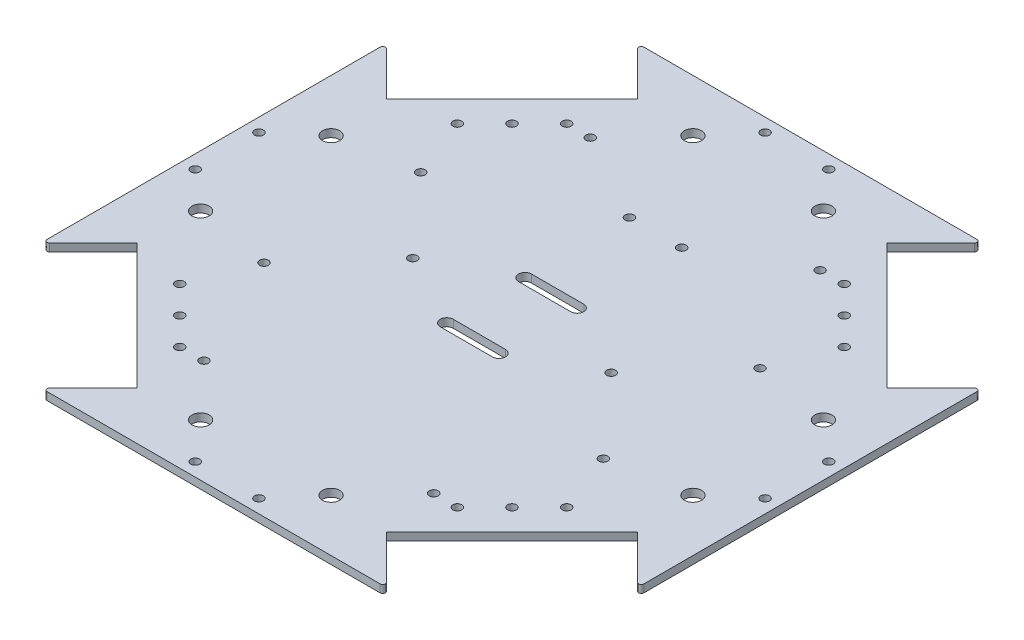
from build123d import *

# Parameters (mm, degrees)
SKETCH1_W                                   = 228.6
SKETCH1_H                                   = 228.6
PLATE_DEPTH                                 = 3
SKETCH8_R                                   = 1.7
MOTOR_MOUNT_HOLES_DEPTH                     = 3
SKETCH9_R                                   = 1.7
CONNECTOR_BOARD_HOLES_DEPTH                 = 3
MOTOR_CONTROLLER_HOLDER_ARDUINO_HOLES_REACH = 163.672
SKETCH11_R                                  = 1.7
CABLE_SLOTS_REACH                           = 163.672
WALL_BRACKET_HOLES_REACH                    = 163.672
SKETCH13_R                                  = 1.7
BATTERY_HOLDER_HOLES_REACH                  = 163.672
SKETCH14_R                                  = 1.7
LOAD_MOUNT_HOLES_REACH                      = 163.672
SKETCH15_R                                  = 3.3
LEVEL2_STANDOFF_HOLES_REACH                 = 163.672
SKETCH10_R                                  = 1.7
WHEEL_SLOTS_DEPTH                           = 3
FILLET1_R                                   = 1


with BuildPart() as part:
    # Sketch1 → plate (new body)
    with BuildSketch(Plane(origin=(0, 0, 0), x_dir=(1, 0, 0), z_dir=(0, 1, 0))):
        Rectangle(SKETCH1_W, SKETCH1_H)
    extrude(amount=PLATE_DEPTH)

    # Sketch8 → motor-mount-holes (cut)
    with BuildSketch(Plane(origin=(0, 3, 0), x_dir=(1, 0, 0), z_dir=(0, 1, 0))):
        with Locations((63.639610307, 63.639610307)):
            Circle(SKETCH8_R)
        with Locations((74.104790668, 53.174429945)):
            Circle(SKETCH8_R)
        with Locations((53.174429945, 74.104790668)):
            Circle(SKETCH8_R)
        with Locations((63.639610307, -63.639610307)):
            Circle(SKETCH8_R)
        with Locations((74.104790668, -53.174429945)):
            Circle(SKETCH8_R)
        with Locations((53.174429945, -74.104790668)):
            Circle(SKETCH8_R)
        with Locations((-63.639610307, -63.639610307)):
            Circle(SKETCH8_R)
        with Locations((-53.174429945, -74.104790668)):
            Circle(SKETCH8_R)
        with Locations((-74.104790668, -53.174429945)):
            Circle(SKETCH8_R)
        with Locations((-63.639610307, 63.639610307)):
            Circle(SKETCH8_R)
        with Locations((-74.104790668, 53.174429945)):
            Circle(SKETCH8_R)
        with Locations((-53.174429945, 74.104790668)):
            Circle(SKETCH8_R)
    extrude(amount=-MOTOR_MOUNT_HOLES_DEPTH, mode=Mode.SUBTRACT)

    # Sketch9 → connector-board-holes (cut)
    with BuildSketch(Plane(origin=(0, 3, 0), x_dir=(1, 0, 0), z_dir=(0, 1, 0))):
        with Locations((-38, 0)):
            Circle(SKETCH9_R)
        with Locations((38, 0)):
            Circle(SKETCH9_R)
    extrude(amount=-CONNECTOR_BOARD_HOLES_DEPTH, mode=Mode.SUBTRACT)

    # Sketch11 → motor-controller-holder-arduino-holes (cut, up to next)
    with BuildSketch(Plane(origin=(0, 3, 0), x_dir=(1, 0, 0), z_dir=(0, 1, 0)), mode=Mode.PRIVATE) as motor_controller_holder_arduino_holes_sk1:
        with Locations((-10, 55)):
            Circle(SKETCH11_R)
    motor_controller_holder_arduino_holes_tool1 = extrude(motor_controller_holder_arduino_holes_sk1.sketch, amount=-MOTOR_CONTROLLER_HOLDER_ARDUINO_HOLES_REACH, mode=Mode.PRIVATE) & part.part
    # Sketch11 → motor-controller-holder-arduino-holes (cut, up to next)
    with BuildSketch(Plane(origin=(0, 3, 0), x_dir=(1, 0, 0), z_dir=(0, 1, 0)), mode=Mode.PRIVATE) as motor_controller_holder_arduino_holes_sk2:
        with Locations((10, 55)):
            Circle(SKETCH11_R)
    motor_controller_holder_arduino_holes_tool2 = extrude(motor_controller_holder_arduino_holes_sk2.sketch, amount=-MOTOR_CONTROLLER_HOLDER_ARDUINO_HOLES_REACH, mode=Mode.PRIVATE) & part.part
    add(motor_controller_holder_arduino_holes_tool1.solids().sort_by_distance((-10, 3, -55))[0], mode=Mode.SUBTRACT)
    add(motor_controller_holder_arduino_holes_tool2.solids().sort_by_distance((10, 3, -55))[0], mode=Mode.SUBTRACT)

    # Sketch12 → cable-slots (cut, up to next)
    with BuildSketch(Plane(origin=(0, 3, 0), x_dir=(1, 0, 0), z_dir=(0, 1, 0)), mode=Mode.PRIVATE) as cable_slots_sk1:
        with BuildLine():
            Line((-10, 17.5), (10, 17.5))
            ThreePointArc((10, 17.5), (12.5, 15), (10, 12.5))
            Line((10, 12.5), (-10, 12.5))
            ThreePointArc((-10, 12.5), (-12.5, 15), (-10, 17.5))
        make_face()
    cable_slots_tool1 = extrude(cable_slots_sk1.sketch, amount=-CABLE_SLOTS_REACH, mode=Mode.PRIVATE) & part.part
    # Sketch12 → cable-slots (cut, up to next)
    with BuildSketch(Plane(origin=(0, 3, 0), x_dir=(1, 0, 0), z_dir=(0, 1, 0)), mode=Mode.PRIVATE) as cable_slots_sk2:
        with BuildLine():
            Line((-10, -12.5), (10, -12.5))
            ThreePointArc((10, -12.5), (12.5, -15), (10, -17.5))
            Line((10, -17.5), (-10, -17.5))
            ThreePointArc((-10, -17.5), (-12.5, -15), (-10, -12.5))
        make_face()
    cable_slots_tool2 = extrude(cable_slots_sk2.sketch, amount=-CABLE_SLOTS_REACH, mode=Mode.PRIVATE) & part.part
    add(cable_slots_tool1.solids().sort_by_distance((0, 3, -15))[0], mode=Mode.SUBTRACT)
    add(cable_slots_tool2.solids().sort_by_distance((0, 3, 15))[0], mode=Mode.SUBTRACT)

    # Sketch13 → wall-bracket-holes (cut, up to next)
    with BuildSketch(Plane(origin=(0, 3, 0), x_dir=(1, 0, 0), z_dir=(0, 1, 0)), mode=Mode.PRIVATE) as wall_bracket_holes_sk1:
        with Locations((-12.2, 109.1438)):
            Circle(SKETCH13_R)
    wall_bracket_holes_tool1 = extrude(wall_bracket_holes_sk1.sketch, amount=-WALL_BRACKET_HOLES_REACH, mode=Mode.PRIVATE) & part.part
    # Sketch13 → wall-bracket-holes (cut, up to next)
    with BuildSketch(Plane(origin=(0, 3, 0), x_dir=(1, 0, 0), z_dir=(0, 1, 0)), mode=Mode.PRIVATE) as wall_bracket_holes_sk2:
        with Locations((12.2, 109.1438)):
            Circle(SKETCH13_R)
    wall_bracket_holes_tool2 = extrude(wall_bracket_holes_sk2.sketch, amount=-WALL_BRACKET_HOLES_REACH, mode=Mode.PRIVATE) & part.part
    # Sketch13 → wall-bracket-holes (cut, up to next)
    with BuildSketch(Plane(origin=(0, 3, 0), x_dir=(1, 0, 0), z_dir=(0, 1, 0)), mode=Mode.PRIVATE) as wall_bracket_holes_sk3:
        with Locations((109.1438, -12.2)):
            Circle(SKETCH13_R)
    wall_bracket_holes_tool3 = extrude(wall_bracket_holes_sk3.sketch, amount=-WALL_BRACKET_HOLES_REACH, mode=Mode.PRIVATE) & part.part
    # Sketch13 → wall-bracket-holes (cut, up to next)
    with BuildSketch(Plane(origin=(0, 3, 0), x_dir=(1, 0, 0), z_dir=(0, 1, 0)), mode=Mode.PRIVATE) as wall_bracket_holes_sk4:
        with Locations((109.1438, 12.2)):
            Circle(SKETCH13_R)
    wall_bracket_holes_tool4 = extrude(wall_bracket_holes_sk4.sketch, amount=-WALL_BRACKET_HOLES_REACH, mode=Mode.PRIVATE) & part.part
    # Sketch13 → wall-bracket-holes (cut, up to next)
    with BuildSketch(Plane(origin=(0, 3, 0), x_dir=(1, 0, 0), z_dir=(0, 1, 0)), mode=Mode.PRIVATE) as wall_bracket_holes_sk5:
        with Locations((-12.2, -109.1438)):
            Circle(SKETCH13_R)
    wall_bracket_holes_tool5 = extrude(wall_bracket_holes_sk5.sketch, amount=-WALL_BRACKET_HOLES_REACH, mode=Mode.PRIVATE) & part.part
    # Sketch13 → wall-bracket-holes (cut, up to next)
    with BuildSketch(Plane(origin=(0, 3, 0), x_dir=(1, 0, 0), z_dir=(0, 1, 0)), mode=Mode.PRIVATE) as wall_bracket_holes_sk6:
        with Locations((12.2, -109.1438)):
            Circle(SKETCH13_R)
    wall_bracket_holes_tool6 = extrude(wall_bracket_holes_sk6.sketch, amount=-WALL_BRACKET_HOLES_REACH, mode=Mode.PRIVATE) & part.part
    # Sketch13 → wall-bracket-holes (cut, up to next)
    with BuildSketch(Plane(origin=(0, 3, 0), x_dir=(1, 0, 0), z_dir=(0, 1, 0)), mode=Mode.PRIVATE) as wall_bracket_holes_sk7:
        with Locations((-109.1438, 12.2)):
            Circle(SKETCH13_R)
    wall_bracket_holes_tool7 = extrude(wall_bracket_holes_sk7.sketch, amount=-WALL_BRACKET_HOLES_REACH, mode=Mode.PRIVATE) & part.part
    # Sketch13 → wall-bracket-holes (cut, up to next)
    with BuildSketch(Plane(origin=(0, 3, 0), x_dir=(1, 0, 0), z_dir=(0, 1, 0)), mode=Mode.PRIVATE) as wall_bracket_holes_sk8:
        with Locations((-109.1438, -12.2)):
            Circle(SKETCH13_R)
    wall_bracket_holes_tool8 = extrude(wall_bracket_holes_sk8.sketch, amount=-WALL_BRACKET_HOLES_REACH, mode=Mode.PRIVATE) & part.part
    add(wall_bracket_holes_tool1.solids().sort_by_distance((-12.2, 3, -109.1438))[0], mode=Mode.SUBTRACT)
    add(wall_bracket_holes_tool2.solids().sort_by_distance((12.2, 3, -109.1438))[0], mode=Mode.SUBTRACT)
    add(wall_bracket_holes_tool3.solids().sort_by_distance((109.1438, 3, 12.2))[0], mode=Mode.SUBTRACT)
    add(wall_bracket_holes_tool4.solids().sort_by_distance((109.1438, 3, -12.2))[0], mode=Mode.SUBTRACT)
    add(wall_bracket_holes_tool5.solids().sort_by_distance((-12.2, 3, 109.1438))[0], mode=Mode.SUBTRACT)
    add(wall_bracket_holes_tool6.solids().sort_by_distance((12.2, 3, 109.1438))[0], mode=Mode.SUBTRACT)
    add(wall_bracket_holes_tool7.solids().sort_by_distance((-109.1438, 3, -12.2))[0], mode=Mode.SUBTRACT)
    add(wall_bracket_holes_tool8.solids().sort_by_distance((-109.1438, 3, 12.2))[0], mode=Mode.SUBTRACT)

    # Sketch14 → battery-holder-holes (cut, up to next)
    with BuildSketch(Plane(origin=(0, 3, 0), x_dir=(1, 0, 0), z_dir=(0, 1, 0)), mode=Mode.PRIVATE) as battery_holder_holes_sk1:
        with Locations((-65, 30)):
            Circle(SKETCH14_R)
    battery_holder_holes_tool1 = extrude(battery_holder_holes_sk1.sketch, amount=-BATTERY_HOLDER_HOLES_REACH, mode=Mode.PRIVATE) & part.part
    # Sketch14 → battery-holder-holes (cut, up to next)
    with BuildSketch(Plane(origin=(0, 3, 0), x_dir=(1, 0, 0), z_dir=(0, 1, 0)), mode=Mode.PRIVATE) as battery_holder_holes_sk2:
        with Locations((-65, -30)):
            Circle(SKETCH14_R)
    battery_holder_holes_tool2 = extrude(battery_holder_holes_sk2.sketch, amount=-BATTERY_HOLDER_HOLES_REACH, mode=Mode.PRIVATE) & part.part
    # Sketch14 → battery-holder-holes (cut, up to next)
    with BuildSketch(Plane(origin=(0, 3, 0), x_dir=(1, 0, 0), z_dir=(0, 1, 0)), mode=Mode.PRIVATE) as battery_holder_holes_sk3:
        with Locations((65, -30)):
            Circle(SKETCH14_R)
    battery_holder_holes_tool3 = extrude(battery_holder_holes_sk3.sketch, amount=-BATTERY_HOLDER_HOLES_REACH, mode=Mode.PRIVATE) & part.part
    # Sketch14 → battery-holder-holes (cut, up to next)
    with BuildSketch(Plane(origin=(0, 3, 0), x_dir=(1, 0, 0), z_dir=(0, 1, 0)), mode=Mode.PRIVATE) as battery_holder_holes_sk4:
        with Locations((65, 30)):
            Circle(SKETCH14_R)
    battery_holder_holes_tool4 = extrude(battery_holder_holes_sk4.sketch, amount=-BATTERY_HOLDER_HOLES_REACH, mode=Mode.PRIVATE) & part.part
    add(battery_holder_holes_tool1.solids().sort_by_distance((-65, 3, -30))[0], mode=Mode.SUBTRACT)
    add(battery_holder_holes_tool2.solids().sort_by_distance((-65, 3, 30))[0], mode=Mode.SUBTRACT)
    add(battery_holder_holes_tool3.solids().sort_by_distance((65, 3, 30))[0], mode=Mode.SUBTRACT)
    add(battery_holder_holes_tool4.solids().sort_by_distance((65, 3, -30))[0], mode=Mode.SUBTRACT)

    # Sketch15 → load-mount-holes (cut, up to next)
    with BuildSketch(Plane(origin=(0, 3, 0), x_dir=(1, 0, 0), z_dir=(0, 1, 0)), mode=Mode.PRIVATE) as load_mount_holes_sk1:
        with Locations((-94.3, 25)):
            Circle(SKETCH15_R)
    load_mount_holes_tool1 = extrude(load_mount_holes_sk1.sketch, amount=-LOAD_MOUNT_HOLES_REACH, mode=Mode.PRIVATE) & part.part
    # Sketch15 → load-mount-holes (cut, up to next)
    with BuildSketch(Plane(origin=(0, 3, 0), x_dir=(1, 0, 0), z_dir=(0, 1, 0)), mode=Mode.PRIVATE) as load_mount_holes_sk2:
        with Locations((-94.3, -25)):
            Circle(SKETCH15_R)
    load_mount_holes_tool2 = extrude(load_mount_holes_sk2.sketch, amount=-LOAD_MOUNT_HOLES_REACH, mode=Mode.PRIVATE) & part.part
    # Sketch15 → load-mount-holes (cut, up to next)
    with BuildSketch(Plane(origin=(0, 3, 0), x_dir=(1, 0, 0), z_dir=(0, 1, 0)), mode=Mode.PRIVATE) as load_mount_holes_sk3:
        with Locations((94.3, 25)):
            Circle(SKETCH15_R)
    load_mount_holes_tool3 = extrude(load_mount_holes_sk3.sketch, amount=-LOAD_MOUNT_HOLES_REACH, mode=Mode.PRIVATE) & part.part
    # Sketch15 → load-mount-holes (cut, up to next)
    with BuildSketch(Plane(origin=(0, 3, 0), x_dir=(1, 0, 0), z_dir=(0, 1, 0)), mode=Mode.PRIVATE) as load_mount_holes_sk4:
        with Locations((94.3, -25)):
            Circle(SKETCH15_R)
    load_mount_holes_tool4 = extrude(load_mount_holes_sk4.sketch, amount=-LOAD_MOUNT_HOLES_REACH, mode=Mode.PRIVATE) & part.part
    # Sketch15 → load-mount-holes (cut, up to next)
    with BuildSketch(Plane(origin=(0, 3, 0), x_dir=(1, 0, 0), z_dir=(0, 1, 0)), mode=Mode.PRIVATE) as load_mount_holes_sk5:
        with Locations((25, 94.3)):
            Circle(SKETCH15_R)
    load_mount_holes_tool5 = extrude(load_mount_holes_sk5.sketch, amount=-LOAD_MOUNT_HOLES_REACH, mode=Mode.PRIVATE) & part.part
    # Sketch15 → load-mount-holes (cut, up to next)
    with BuildSketch(Plane(origin=(0, 3, 0), x_dir=(1, 0, 0), z_dir=(0, 1, 0)), mode=Mode.PRIVATE) as load_mount_holes_sk6:
        with Locations((-25, 94.3)):
            Circle(SKETCH15_R)
    load_mount_holes_tool6 = extrude(load_mount_holes_sk6.sketch, amount=-LOAD_MOUNT_HOLES_REACH, mode=Mode.PRIVATE) & part.part
    # Sketch15 → load-mount-holes (cut, up to next)
    with BuildSketch(Plane(origin=(0, 3, 0), x_dir=(1, 0, 0), z_dir=(0, 1, 0)), mode=Mode.PRIVATE) as load_mount_holes_sk7:
        with Locations((25, -94.3)):
            Circle(SKETCH15_R)
    load_mount_holes_tool7 = extrude(load_mount_holes_sk7.sketch, amount=-LOAD_MOUNT_HOLES_REACH, mode=Mode.PRIVATE) & part.part
    # Sketch15 → load-mount-holes (cut, up to next)
    with BuildSketch(Plane(origin=(0, 3, 0), x_dir=(1, 0, 0), z_dir=(0, 1, 0)), mode=Mode.PRIVATE) as load_mount_holes_sk8:
        with Locations((-25, -94.3)):
            Circle(SKETCH15_R)
    load_mount_holes_tool8 = extrude(load_mount_holes_sk8.sketch, amount=-LOAD_MOUNT_HOLES_REACH, mode=Mode.PRIVATE) & part.part
    add(load_mount_holes_tool1.solids().sort_by_distance((-94.3, 3, -25))[0], mode=Mode.SUBTRACT)
    add(load_mount_holes_tool2.solids().sort_by_distance((-94.3, 3, 25))[0], mode=Mode.SUBTRACT)
    add(load_mount_holes_tool3.solids().sort_by_distance((94.3, 3, -25))[0], mode=Mode.SUBTRACT)
    add(load_mount_holes_tool4.solids().sort_by_distance((94.3, 3, 25))[0], mode=Mode.SUBTRACT)
    add(load_mount_holes_tool5.solids().sort_by_distance((25, 3, -94.3))[0], mode=Mode.SUBTRACT)
    add(load_mount_holes_tool6.solids().sort_by_distance((-25, 3, -94.3))[0], mode=Mode.SUBTRACT)
    add(load_mount_holes_tool7.solids().sort_by_distance((25, 3, 94.3))[0], mode=Mode.SUBTRACT)
    add(load_mount_holes_tool8.solids().sort_by_distance((-25, 3, 94.3))[0], mode=Mode.SUBTRACT)

    # Sketch10 → level2-standoff-holes (cut, up to next)
    with BuildSketch(Plane(origin=(0, 3, 0), x_dir=(1, 0, 0), z_dir=(0, 1, 0)), mode=Mode.PRIVATE) as level2_standoff_holes_sk1:
        with Locations((44, 74)):
            Circle(SKETCH10_R)
    level2_standoff_holes_tool1 = extrude(level2_standoff_holes_sk1.sketch, amount=-LEVEL2_STANDOFF_HOLES_REACH, mode=Mode.PRIVATE) & part.part
    # Sketch10 → level2-standoff-holes (cut, up to next)
    with BuildSketch(Plane(origin=(0, 3, 0), x_dir=(1, 0, 0), z_dir=(0, 1, 0)), mode=Mode.PRIVATE) as level2_standoff_holes_sk2:
        with Locations((44, -74)):
            Circle(SKETCH10_R)
    level2_standoff_holes_tool2 = extrude(level2_standoff_holes_sk2.sketch, amount=-LEVEL2_STANDOFF_HOLES_REACH, mode=Mode.PRIVATE) & part.part
    # Sketch10 → level2-standoff-holes (cut, up to next)
    with BuildSketch(Plane(origin=(0, 3, 0), x_dir=(1, 0, 0), z_dir=(0, 1, 0)), mode=Mode.PRIVATE) as level2_standoff_holes_sk3:
        with Locations((-44, -74)):
            Circle(SKETCH10_R)
    level2_standoff_holes_tool3 = extrude(level2_standoff_holes_sk3.sketch, amount=-LEVEL2_STANDOFF_HOLES_REACH, mode=Mode.PRIVATE) & part.part
    # Sketch10 → level2-standoff-holes (cut, up to next)
    with BuildSketch(Plane(origin=(0, 3, 0), x_dir=(1, 0, 0), z_dir=(0, 1, 0)), mode=Mode.PRIVATE) as level2_standoff_holes_sk4:
        with Locations((-44, 74)):
            Circle(SKETCH10_R)
    level2_standoff_holes_tool4 = extrude(level2_standoff_holes_sk4.sketch, amount=-LEVEL2_STANDOFF_HOLES_REACH, mode=Mode.PRIVATE) & part.part
    add(level2_standoff_holes_tool1.solids().sort_by_distance((44, 3, -74))[0], mode=Mode.SUBTRACT)
    add(level2_standoff_holes_tool2.solids().sort_by_distance((44, 3, 74))[0], mode=Mode.SUBTRACT)
    add(level2_standoff_holes_tool3.solids().sort_by_distance((-44, 3, 74))[0], mode=Mode.SUBTRACT)
    add(level2_standoff_holes_tool4.solids().sort_by_distance((-44, 3, -74))[0], mode=Mode.SUBTRACT)

    # Sketch2 → wheel-slots (cut)
    with BuildSketch(Plane(origin=(0, 3, 0), x_dir=(1, 0, 0), z_dir=(0, 1, 0))):
        Polygon((114.3, 114.3), (66.216738879, 114.3), (47.800418408, 95.883679529), (95.883679529, 47.800418408), (114.3, 66.216738879), align=None)
        Polygon((66.216738879, -114.3), (114.3, -114.3), (114.3, -66.216738879), (95.883679529, -47.800418408), (47.800418408, -95.883679529), align=None)
        Polygon((-114.3, -66.216738879), (-114.3, -114.3), (-66.216738879, -114.3), (-47.800418408, -95.883679529), (-95.883679529, -47.800418408), align=None)
        Polygon((-66.216738879, 114.3), (-114.3, 114.3), (-114.3, 66.216738879), (-95.883679529, 47.800418408), (-47.800418408, 95.883679529), align=None)
    extrude(amount=-WHEEL_SLOTS_DEPTH, mode=Mode.SUBTRACT)

    # Fillet1
    fillet1_edges = [part.edges().sort_by_distance(p)[0] for p in [
        (66.216738879, 1.5, -114.3),
        (114.3, 1.5, -66.216738879),
        (114.3, 1.5, 66.216738879),
        (-66.216738879, 1.5, -114.3),
        (-114.3, 1.5, -66.216738879),
        (-114.3, 1.5, 66.216738879),
        (-66.216738879, 1.5, 114.3),
        (66.216738879, 1.5, 114.3),
    ]]
    fillet(fillet1_edges, radius=FILLET1_R)


solid = part.part
